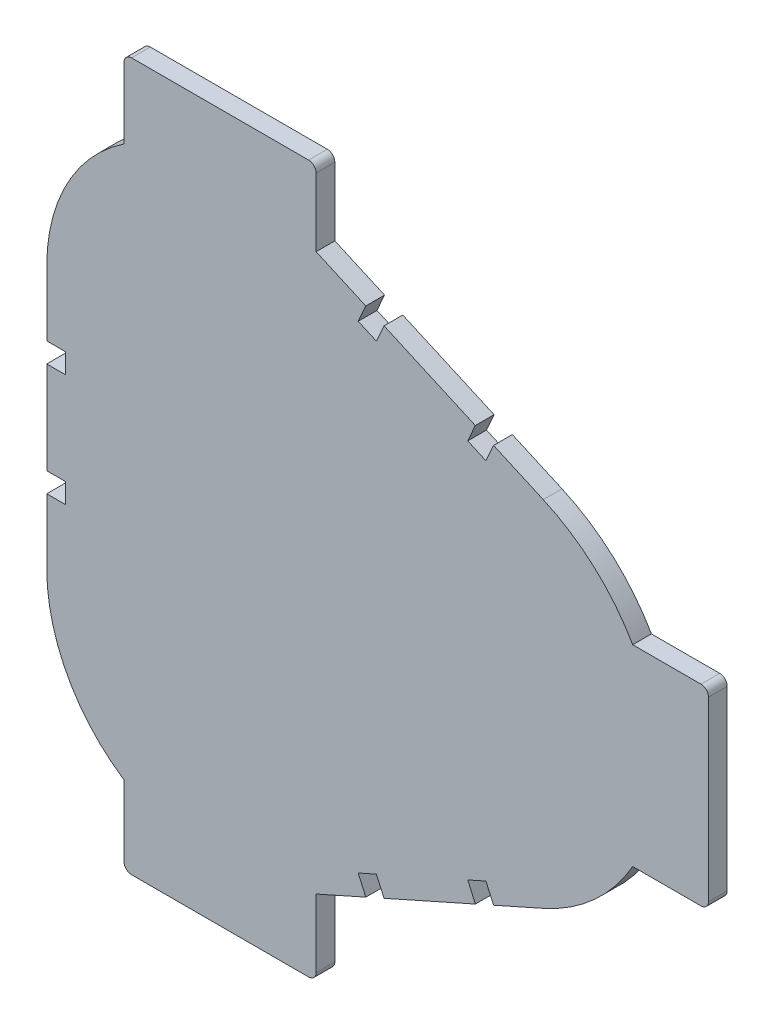
from build123d import *

# Parameters (mm, degrees)
BOSS_EXTRUDE1_DEPTH = 6.35


with BuildPart() as part:
    # Sketch1 → Boss-Extrude1 (new body)
    with BuildSketch(Plane(origin=(0, 0, -130.81), x_dir=(-1, 0, 0), z_dir=(0, 0, -1))):
        with BuildLine():
            Line((76.876798569, 59.314378099), (76.876798569, 81.336178099))
            ThreePointArc((76.876798569, 81.336178099), (69.915897636, 109.072033869), (50.683048569, 130.234012838))
            Line((50.683048569, 130.234012838), (50.683048569, 154.219312576))
            ThreePointArc((50.683048569, 154.219312576), (49.939099793, 156.0153638), (48.143048569, 156.759312576))
            Line((48.143048569, 156.759312576), (-11.864451431, 156.759312576))
            ThreePointArc((-11.864451431, 156.759312576), (-13.660502655, 156.0153638), (-14.404451431, 154.219312576))
            Line((-14.404451431, 154.219312576), (-14.404451431, 131.142265008))
            Line((-14.404451431, 131.142265008), (-31.24063717, 123.644948976))
            Line((-31.24063717, 123.644948976), (-28.657467512, 117.844109854))
            Line((-28.657467512, 117.844109854), (-34.829560338, 115.095617339))
            Line((-34.829560338, 115.095617339), (-37.412729996, 120.896456461))
            Line((-37.412729996, 120.896456461), (-68.366007552, 107.112663169))
            Line((-68.366007552, 107.112663169), (-65.782837894, 101.311824047))
            Line((-65.782837894, 101.311824047), (-71.95493072, 98.563331532))
            Line((-71.95493072, 98.563331532), (-74.538100378, 104.364170654))
            Line((-74.538100378, 104.364170654), (-91.374286117, 96.866854622))
            ThreePointArc((-91.374286117, 96.866854622), (-108.722690302, 85.568449718), (-121.690697129, 69.429928099))
            Line((-121.690697129, 69.429928099), (-144.83728746, 69.429928099))
            ThreePointArc((-144.83728746, 69.429928099), (-146.633338684, 68.685979323), (-147.37728746, 66.889928099))
            Line((-147.37728746, 66.889928099), (-147.37728746, 6.882428099))
            ThreePointArc((-147.37728746, 6.882428099), (-146.633338684, 5.086376875), (-144.83728746, 4.342428099))
            Line((-144.83728746, 4.342428099), (-121.690697129, 4.342428099))
            ThreePointArc((-121.690697129, 4.342428099), (-108.722690302, -11.79609352), (-91.374286117, -23.094498424))
            Line((-91.374286117, -23.094498424), (-74.538100378, -30.591814456))
            Line((-74.538100378, -30.591814456), (-71.95493072, -24.790975333))
            Line((-71.95493072, -24.790975333), (-65.782837894, -27.539467849))
            Line((-65.782837894, -27.539467849), (-68.366007552, -33.340306971))
            Line((-68.366007552, -33.340306971), (-37.412729996, -47.124100263))
            Line((-37.412729996, -47.124100263), (-34.829560338, -41.323261141))
            Line((-34.829560338, -41.323261141), (-28.657467512, -44.071753656))
            Line((-28.657467512, -44.071753656), (-31.24063717, -49.872592778))
            Line((-31.24063717, -49.872592778), (-14.404451431, -57.36990881))
            Line((-14.404451431, -57.36990881), (-14.404451431, -80.446956378))
            ThreePointArc((-14.404451431, -80.446956378), (-13.660502655, -82.243007602), (-11.864451431, -82.986956378))
            Line((-11.864451431, -82.986956378), (48.143048569, -82.986956378))
            ThreePointArc((48.143048569, -82.986956378), (49.939099793, -82.243007602), (50.683048569, -80.446956378))
            Line((50.683048569, -80.446956378), (50.683048569, -56.46165664))
            ThreePointArc((50.683048569, -56.46165664), (69.915897636, -35.299677671), (76.876798569, -7.563821901))
            Line((76.876798569, -7.563821901), (76.876798569, 14.457978099))
            Line((76.876798569, 14.457978099), (70.526798569, 14.457978099))
            Line((70.526798569, 14.457978099), (70.526798569, 21.214378099))
            Line((70.526798569, 21.214378099), (76.876798569, 21.214378099))
            Line((76.876798569, 21.214378099), (76.876798569, 52.557978099))
            Line((76.876798569, 52.557978099), (70.526798569, 52.557978099))
            Line((70.526798569, 52.557978099), (70.526798569, 59.314378099))
            Line((70.526798569, 59.314378099), (76.876798569, 59.314378099))
        make_face()
    extrude(amount=BOSS_EXTRUDE1_DEPTH)


solid = part.part
